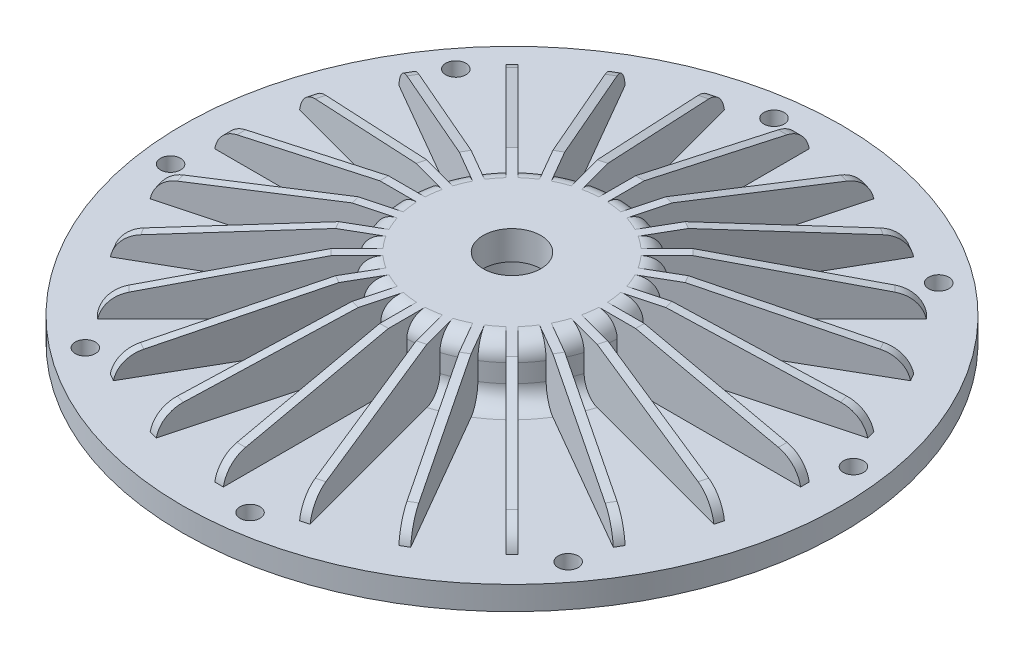
from build123d import *

# Parameters (mm, degrees)
SKETCH2_R                = 3.5
CUT_EXTRUDE1_DEPTH       = 163.687199865
CIRPATTERN1_COUNT        = 8
FILLET2_R                = 6.35
RIB1_START               = -1.5
RIB1_DEPTH               = 3
FILLET3_R                = 10
CIRPATTERN2_COUNT        = 24
FILLET3_OF_CIRPATTERN2_R = 10


# Read off the part's stored shape, not the designer's step: Rib1
with BuildPart() as part:
    # Sketch1 → Revolve1 (revolve)
    with BuildSketch(Plane(origin=(0, 0, 0), x_dir=(0, 0, -1), z_dir=(1, 0, 0)), mode=Mode.PRIVATE) as revolve1_sk:
        Polygon((-10, 35.35), (-38, 35.35), (-38, 16.35), (-114.25, 16.35), (-114.25, 8.175), (-101.55, 8.175), (-101.55, 0), (-20.05, 0), (-20.05, 6.35), (-16.88, 6.35), (-16.88, 25.35), (-10, 25.35), align=None)
    revolve(revolve1_sk.sketch.rotate(Axis((0, 0, 0), (0, 1, 0)), 180), axis=Axis((0, 0, 0), (0, 1, 0)))

    # Sketch2 → Cut-Extrude1 (cut, through all)
    with BuildSketch(Plane(origin=(0, 16.35, 0), x_dir=(1, 0, 0), z_dir=(0, 1, 0))):
        with Locations(Location((104.597432875, 13.770513279, 0), (0, 0, 270))):
            Circle(SKETCH2_R)
    cut_extrude1 = extrude(amount=-CUT_EXTRUDE1_DEPTH, mode=Mode.SUBTRACT)

    # CirPattern1: Cut-Extrude1 ×8 about axis
    cirpattern1_axis = Axis((0, 0, 0), (0, 1, 0))
    for i in range(1, CIRPATTERN1_COUNT):
        add(cut_extrude1.rotate(cirpattern1_axis, i * 360 / CIRPATTERN1_COUNT), mode=Mode.SUBTRACT)

    # Fillet2
    fillet2_edges = [part.edges().sort_by_distance(p)[0] for p in [
        (0, 16.35, 38),
        (0, 35.35, 38),
    ]]
    fillet(fillet2_edges, radius=FILLET2_R)

    # Rib1 outline → Rib1 (add)
    with BuildSketch(Plane.XY.offset(RIB1_START)):
        Polygon((44.35, 35.35), (30, 35.35), (30, 16.35), (101.55, 16.35), (101.55, 22.7), align=None)
    rib1 = extrude(amount=RIB1_DEPTH)

    # Fillet3
    # the kernel refuses this fillet: 10 mm, written as the material it takes off along each edge
    with BuildSketch(Plane(origin=(101.55, 22.7, -21.196866384), x_dir=(-0.9764074606986908, 0.21593626534682578, 0), z_dir=(0, 0, 1))) as fillet3_piece_1:
        with BuildLine():
            CenterArc((7.878746554, 10), FILLET3_R, 202.332522016, 67.667477984)
            Line((-1.371195285, 6.200187375), (-1.556194122, 6.124191123))
            ThreePointArc((-1.556194122, 6.124191123), (-0.880879135, 3.056906435), (-0.195281492, -0.043187253))
            Line((-0.195281492, -0.043187253), (0, -0.2))
            Line((0, -0.2), (7.878746554, -0.2))
            Line((7.878746554, -0.2), (7.878746554, 0))
        make_face()
    extrude(amount=42.393732768, mode=Mode.SUBTRACT)

    # CirPattern2: Rib1 ×24 about axis
    cirpattern2_axis = Axis((0, 0, 0), (0, 1, 0))
    for i in range(1, CIRPATTERN2_COUNT):
        add(rib1.rotate(cirpattern2_axis, i * 360 / CIRPATTERN2_COUNT))

    # Fillet3 of CirPattern2
    # the kernel refuses this fillet: 10 mm, written as the material it takes off along each edge
    with BuildSketch(Plane(origin=(92.603614943, 22.7, -46.757674707), x_dir=(-0.9431371832701937, 0.21593626534682608, 0.2527128466090121), z_dir=(0.25881904510252074, 0, 0.9659258262890683)), Plane(origin=(77.346446562, 22.7, -69.132024769), x_dir=(-0.845593665409722, 0.21593626534682572, 0.4882037303493453), z_dir=(0.49999999999999994, 0, 0.8660254037844387)), Plane(origin=(56.818245669, 22.7, -86.79514159), x_dir=(-0.6904243366611817, 0.2159362653468261, 0.6904243366611815), z_dir=(0.7071067811865475, 0, 0.7071067811865476)), Plane(origin=(32.417975231, 22.7, -98.543312946), x_dir=(-0.4882037303493454, 0.2159362653468261, 0.8455936654097219), z_dir=(0.8660254037844386, 0, 0.5000000000000001)), Plane(origin=(5.808473353, 22.7, -103.575920376), x_dir=(-0.25271284660901217, 0.21593626534682567, 0.9431371832701938), z_dir=(0.9659258262890683, 0, 0.25881904510252074)), Plane(origin=(-21.196866384, 22.7, -101.55), x_dir=(0, 0.21593626534682578, 0.9764074606986908), z_dir=(1, 0, 0)), Plane(origin=(-46.757674707, 22.7, -92.603614943), x_dir=(0.2527128466090122, 0.21593626534682525, 0.9431371832701939), z_dir=(0.9659258262890683, 0, -0.25881904510252074)), Plane(origin=(-69.132024769, 22.7, -77.346446562), x_dir=(0.4882037303493451, 0.2159362653468258, 0.8455936654097221), z_dir=(0.8660254037844388, 0, -0.49999999999999983)), Plane(origin=(-86.79514159, 22.7, -56.818245669), x_dir=(0.6904243366611814, 0.21593626534682622, 0.6904243366611816), z_dir=(0.7071067811865476, 0, -0.7071067811865475)), Plane(origin=(-98.543312946, 22.7, -32.417975231), x_dir=(0.845593665409722, 0.21593626534682592, 0.4882037303493452), z_dir=(0.49999999999999994, 0, -0.8660254037844388)), Plane(origin=(-103.575920376, 22.7, -5.808473353), x_dir=(0.9431371832701937, 0.21593626534682564, 0.25271284660901244), z_dir=(0.258819045102521, 0, -0.9659258262890682)), Plane(origin=(-101.55, 22.7, 21.196866384), x_dir=(0.9764074606986908, 0.21593626534682578, 0), z_dir=(0, 0, -1)), Plane(origin=(-92.603614943, 22.7, 46.757674707), x_dir=(0.9431371832701938, 0.21593626534682567, -0.2527128466090123), z_dir=(-0.25881904510252085, 0, -0.9659258262890683)), Plane(origin=(-77.346446562, 22.7, 69.132024769), x_dir=(0.8455936654097219, 0.21593626534682592, -0.48820373034934544), z_dir=(-0.5000000000000001, 0, -0.8660254037844386)), Plane(origin=(-56.818245669, 22.7, 86.79514159), x_dir=(0.6904243366611816, 0.2159362653468258, -0.6904243366611814), z_dir=(-0.7071067811865475, 0, -0.7071067811865477)), Plane(origin=(-32.417975231, 22.7, 98.543312946), x_dir=(0.4882037303493458, 0.21593626534682586, -0.8455936654097217), z_dir=(-0.8660254037844384, 0, -0.5000000000000004)), Plane(origin=(-5.808473353, 22.7, 103.575920376), x_dir=(0.25271284660901217, 0.21593626534682567, -0.9431371832701938), z_dir=(-0.9659258262890683, 0, -0.25881904510252074)), Plane(origin=(21.196866384, 22.7, 101.55), x_dir=(0, 0.21593626534682614, -0.9764074606986906), z_dir=(-1, 0, 0)), Plane(origin=(46.757674707, 22.7, 92.603614943), x_dir=(-0.2527128466090118, 0.21593626534682567, -0.9431371832701939), z_dir=(-0.9659258262890684, 0, 0.2588190451025203)), Plane(origin=(69.132024769, 22.7, 77.346446562), x_dir=(-0.48820373034934544, 0.2159362653468258, -0.8455936654097219), z_dir=(-0.8660254037844386, 0, 0.5000000000000001)), Plane(origin=(86.79514159, 22.7, 56.818245669), x_dir=(-0.6904243366611815, 0.2159362653468261, -0.6904243366611817), z_dir=(-0.7071067811865477, 0, 0.7071067811865474)), Plane(origin=(98.543312946, 22.7, 32.417975231), x_dir=(-0.8455936654097218, 0.2159362653468258, -0.4882037303493458), z_dir=(-0.5000000000000004, 0, 0.8660254037844384))) as fillet3_of_cirpattern2_piece_1:
        with BuildLine():
            CenterArc((7.878746554, 10), FILLET3_OF_CIRPATTERN2_R, 202.332522016, 67.667477984)
            Line((-1.371195285, 6.200187375), (-1.556194122, 6.124191123))
            ThreePointArc((-1.556194122, 6.124191123), (-0.880879135, 3.056906435), (-0.195281492, -0.043187253))
            Line((-0.195281492, -0.043187253), (0, -0.2))
            Line((0, -0.2), (7.878746554, -0.2))
            Line((7.878746554, -0.2), (7.878746554, 0))
        make_face()
    extrude(amount=42.393732768, mode=Mode.SUBTRACT)
    with BuildSketch(Plane(origin=(103.575920376, 22.7, 5.808473353), x_dir=(0, -1, 0), z_dir=(-0.2588190451025207, 0, 0.9659258262890683))) as fillet3_of_cirpattern2_piece_2:
        with BuildLine():
            CenterArc((8.062767501, -9.852229569), FILLET3_OF_CIRPATTERN2_R, 99.862060295, 67.667477984)
            Line((-1.701307106, -7.692866916), (-1.896588599, -7.649679663))
            Line((-1.896588599, -7.649679663), (-0.195281492, 0.043187253))
            Line((-0.195281492, 0.043187253), (0, 0.2))
            ThreePointArc((0, 0.2), (3.175, 0.2), (6.31574465, 0.197044591))
            Line((6.31574465, 0.197044591), (6.35, 0))
        make_face()
    extrude(amount=42.393732768, mode=Mode.SUBTRACT)


solid = part.part
